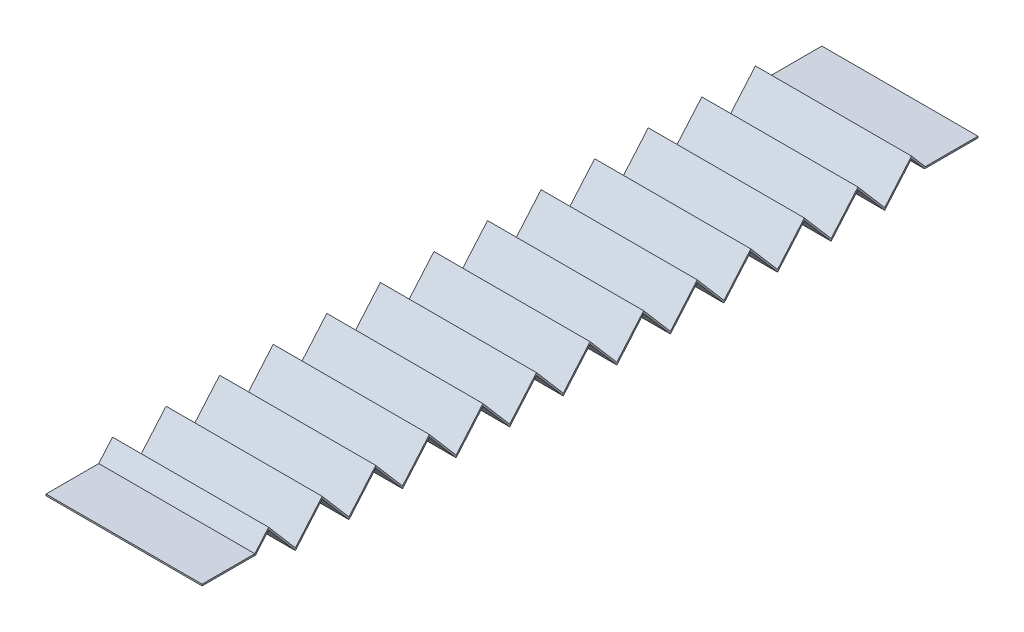
from build123d import *

# Parameters (mm, degrees)
EXTRUDE_THIN1_DEPTH = 25


with BuildPart() as part:
    # Sketch3 → Extrude-Thin1 (new, symmetric)
    with BuildSketch(Plane(origin=(0, 0, 0), x_dir=(0, 0, -1), z_dir=(1, 0, 0))):
        Polygon((0, 4.75), (17.114919694, 4.75), (21.289383497, 9.616041712), (29.868150491, -0.383958288), (38.446917485, 9.616041712), (47.025684479, -0.383958288), (55.604451474, 9.616041712), (64.183218468, -0.383958288), (72.761985462, 9.616041712), (81.340752456, -0.383958288), (89.91951945, 9.616041712), (98.498286444, -0.383958288), (107.077053438, 9.616041712), (115.655820432, -0.383958288), (124.234587427, 9.616041712), (132.813354421, -0.383958288), (141.392121415, 9.616041712), (149.970888409, -0.383958288), (158.549655403, 9.616041712), (167.128422397, -0.383958288), (175.707189391, 9.616041712), (184.285956385, -0.383958288), (192.86472338, 9.616041712), (201.443490374, -0.383958288), (210.022257368, 9.616041712), (218.601024362, -0.383958288), (227.179791356, 9.616041712), (231.354255159, 4.75), (248.469174853, 4.75), (248.469174853, 5.25), (231.584094547, 5.25), (227.179791356, 10.383958288), (218.601024362, 0.383958288), (210.022257368, 10.383958288), (201.443490374, 0.383958288), (192.86472338, 10.383958288), (184.285956385, 0.383958288), (175.707189391, 10.383958288), (167.128422397, 0.383958288), (158.549655403, 10.383958288), (149.970888409, 0.383958288), (141.392121415, 10.383958288), (132.813354421, 0.383958288), (124.234587427, 10.383958288), (115.655820432, 0.383958288), (107.077053438, 10.383958288), (98.498286444, 0.383958288), (89.91951945, 10.383958288), (81.340752456, 0.383958288), (72.761985462, 10.383958288), (64.183218468, 0.383958288), (55.604451474, 10.383958288), (47.025684479, 0.383958288), (38.446917485, 10.383958288), (29.868150491, 0.383958288), (21.289383497, 10.383958288), (16.885080306, 5.25), (0, 5.25), align=None)
    extrude(amount=EXTRUDE_THIN1_DEPTH, both=True)


solid = part.part
